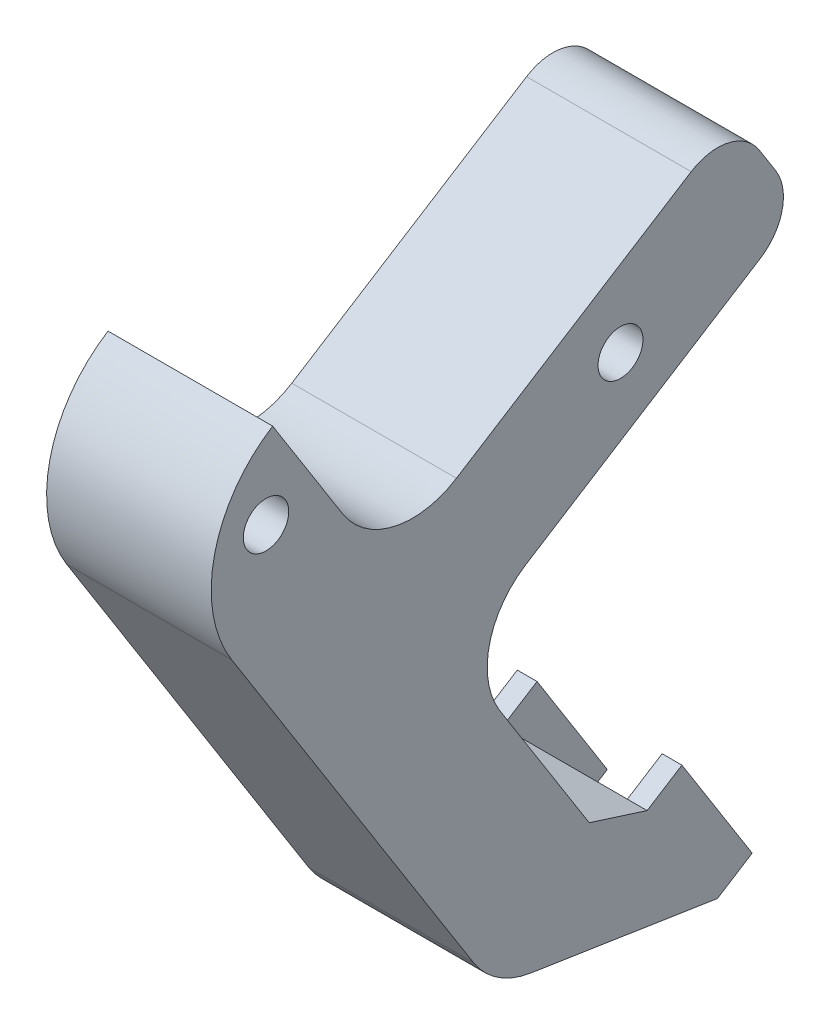
from build123d import *

# Parameters (mm, degrees)
BOSS_EXTRUDE1_DEPTH      = 6.35
BOSS_EXTRUDE1_DEPTH_BACK = 6.35
SKETCH2_R                = 1.733880633
FILLET1_R                = 10.16
BOSS_EXTRUDE3_DEPTH      = 3.175
SKETCH7_R                = 1.7526
CUT_EXTRUDE3_DEPTH       = 22.606


with BuildPart() as part:
    # Sketch2 → Boss-Extrude1 (new, two sides: drawn at the far end of the back side and taken through both)
    with BuildSketch(Plane(origin=(0, 13820.707967808, 11763.157588594), x_dir=(0, 0.8457184946773667, 0.533629298071844), z_dir=(1, 0, 0)).offset(-BOSS_EXTRUDE1_DEPTH_BACK)):
        with BuildLine():
            Line((77.82010292, 2.698073613), (77.82010292, -12.045648124))
            ThreePointArc((77.82010292, -12.045648124), (78.936026083, -14.73972496), (81.63010292, -15.855648124))
            Line((81.63010292, -15.855648124), (84.011557282, -15.855648124))
            ThreePointArc((84.011557282, -15.855648124), (86.705634118, -14.73972496), (87.821557282, -12.045648124))
            Line((87.821557282, -12.045648124), (87.821557282, 2.698073613))
            Line((87.821557282, 2.698073613), (87.821557282, 9.367220025))
            ThreePointArc((87.821557282, 9.367220025), (89.681429221, 13.857348086), (94.171557282, 15.717220025))
            Line((94.171557282, 15.717220025), (104.328561269, 15.717220025))
            Line((104.328561269, 15.717220025), (104.328561269, 25.877220025))
            Line((104.328561269, 25.877220025), (59.175813007, 25.877220025))
            ThreePointArc((59.175813007, 25.877220025), (56.544296522, 25.306287509), (54.385982659, 23.696155769))
            Line((54.385982659, 23.696155769), (44.81523307, 12.7))
            Line((44.81523307, 12.7), (53.583504994, 12.7))
            Line((53.583504994, 12.7), (54.97523307, 12.7))
            Line((54.97523307, 12.7), (56.039282698, 13.597053748))
            Line((56.039282698, 13.597053748), (58.554139967, 15.717220025))
            Line((58.554139967, 15.717220025), (71.47010292, 15.717220025))
            ThreePointArc((71.47010292, 15.717220025), (75.96023098, 13.857348086), (77.82010292, 9.367220025))
            Line((77.82010292, 9.367220025), (77.82010292, 2.698073613))
        make_face()
        with Locations(Location((82.820830101, -2.442575088, 0), (0, 0, 237.748998542))):
            Circle(SKETCH2_R, mode=Mode.SUBTRACT)
    extrude(amount=BOSS_EXTRUDE1_DEPTH + BOSS_EXTRUDE1_DEPTH_BACK)

    # Fillet1
    fillet1_edges = [part.edges().sort_by_distance(p)[0] for p in [
        (0, 13895.131718838, 11840.715209079),
    ]]
    fillet(fillet1_edges, radius=FILLET1_R - 0.0001)  # a hair under: the kernel refuses the full size

    # Sketch5 → Boss-Extrude3 (add)
    with BuildSketch(Plane(origin=(0, -1379.90412378, 2186.930969826), x_dir=(-1, 0, 0), z_dir=(0, 0.5336292980726433, -0.8457184946768624))):
        Polygon((4.826, 18020.569098092), (4.826, 18011.9803546), (4.826, 18010.409098092), (6.35, 18010.409098092), (6.35, 18012.025656104), (6.35, 18020.569098092), align=None)
        Polygon((-6.35, 18011.9803546), (-6.35, 18020.569098092), (-4.826, 18020.569098092), (-4.826, 18011.9803546), (-4.826, 18010.409098092), (-6.35, 18010.409098092), align=None)
    extrude(amount=BOSS_EXTRUDE3_DEPTH)

    # Sketch7 → Cut-Extrude3 (cut)
    with BuildSketch(Plane(origin=(6.35, 0, 0), x_dir=(0, 0, -1), z_dir=(1, 0, 0))):
        with Locations((-11832.634859183, 13894.225281819)):
            Circle(SKETCH7_R)
    extrude(amount=-CUT_EXTRUDE3_DEPTH, mode=Mode.SUBTRACT)


solid = part.part
